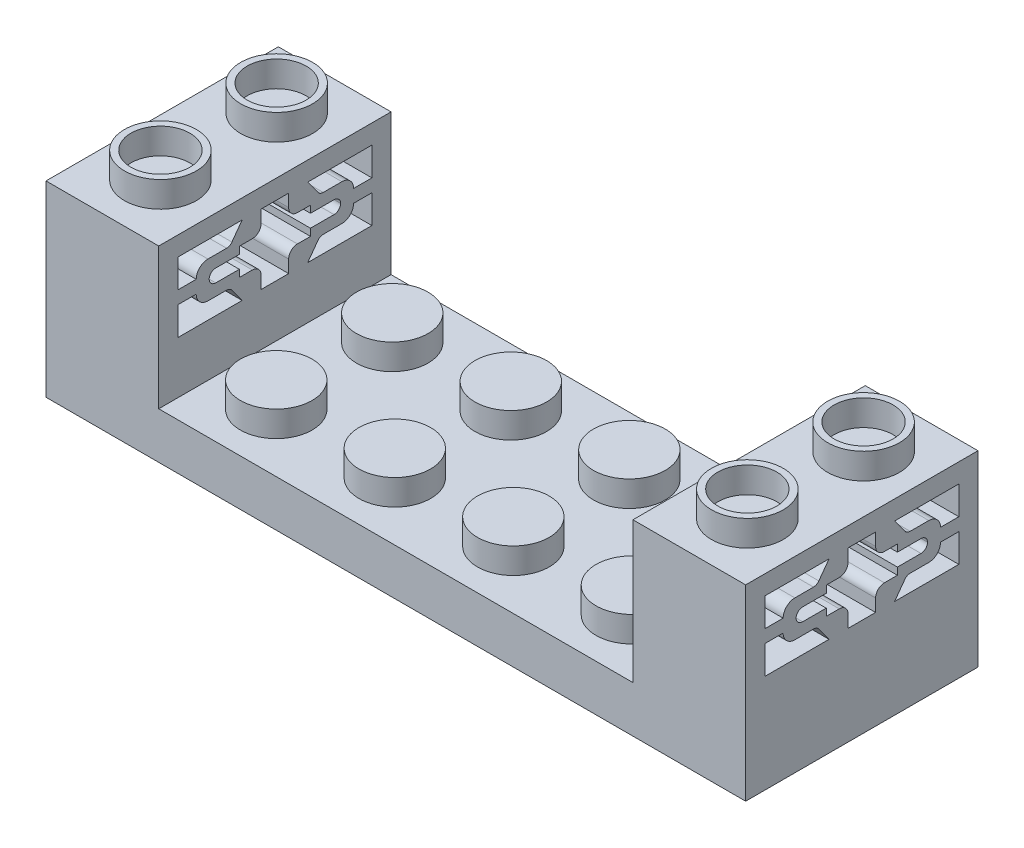
from build123d import *

# Parameters (mm, degrees)
SKETCH2_W               = 47.79
SKETCH2_H               = 12.8
BOSS_EXTRUDE1_DEPTH     = 15.87
CUT_EXTRUDE1_DEPTH      = 30.390269223
CUT_EXTRUDE1_DEPTH_BACK = 30.390269223
SKETCH4_R               = 2.455
SKETCH4_R_2             = 2.015
BOSS_EXTRUDE2_DEPTH     = 1.76
SKETCH5_R               = 2.45
BOSS_EXTRUDE3_DEPTH     = 1.75
SKETCH6_W               = 31.85
SKETCH6_H               = 12.67
CUT_EXTRUDE3_DEPTH      = 1.6
SKETCH7_R               = 1.65
CUT_EXTRUDE4_DEPTH      = 1.85
SKETCH8_W               = 4.69
SKETCH8_H               = 12.83
CUT_EXTRUDE6_DEPTH      = 5.52
SKETCH9_R               = 3.23
SKETCH9_R_2             = 2.83
BOSS_EXTRUDE5_DEPTH     = 1.4
SKETCH10_R              = 1.48
SKETCH10_R_2            = 1.015
BOSS_EXTRUDE6_DEPTH     = 5.32
SKETCH11_R              = 1.48
SKETCH11_R_2            = 1.015
BOSS_EXTRUDE7_DEPTH     = 5.32
CUT_EXTRUDE7_DEPTH      = 52.013004224
FILLET1_R               = 0.6
FILLET2_R               = 0.8
FILLET3_R               = 0.45
FILLET4_R               = 0.45
FILLET5_R               = 0.45


# Some blends are built 0.0001 mm under size
with BuildPart() as part:
    # Sketch2 → Boss-Extrude1 (new body)
    with BuildSketch(Plane.XY):
        Rectangle(SKETCH2_W, SKETCH2_H)
    extrude(amount=-BOSS_EXTRUDE1_DEPTH)

    # Sketch3 → Cut-Extrude1 (cut, two sides: drawn at the far end of the back side and taken through both)
    with BuildSketch(Plane.XY.offset(-CUT_EXTRUDE1_DEPTH_BACK)):
        Polygon((-16.195, 100.567644615), (-16.195, 6.4), (-16.195, -3.23), (16.195, -3.23), (16.195, 6.4), (16.195, 100.567644615), (16.195, 288.902933844), (-16.195, 288.902933844), align=None)
    extrude(amount=CUT_EXTRUDE1_DEPTH + CUT_EXTRUDE1_DEPTH_BACK, mode=Mode.SUBTRACT)

    # Sketch4 → Boss-Extrude2 (add)
    # profile 1 of 4: a face of its own
    with BuildSketch(Plane(origin=(0, 6.4, 0), x_dir=(1, 0, 0), z_dir=(0, 1, 0))):
        with Locations(Location((-20.045, 11.905, 0), (0, 0, 270))):
            Circle(SKETCH4_R)
        with Locations(Location((-20.045, 11.905, 0), (0, 0, 270))):
            Circle(SKETCH4_R_2, mode=Mode.SUBTRACT)
    # profile 2 of 4: a face of its own
    with BuildSketch(Plane(origin=(0, 6.4, 0), x_dir=(1, 0, 0), z_dir=(0, 1, 0))):
        with Locations(Location((-20.045, 3.965, 0), (0, 0, 90))):
            Circle(SKETCH4_R)
        with Locations(Location((-20.045, 3.965, 0), (0, 0, 270))):
            Circle(SKETCH4_R_2, mode=Mode.SUBTRACT)
    # profile 3 of 4: a face of its own
    with BuildSketch(Plane(origin=(0, 6.4, 0), x_dir=(1, 0, 0), z_dir=(0, 1, 0))):
        with Locations(Location((20.045, 3.965, 0), (0, 0, 270))):
            Circle(SKETCH4_R)
        with Locations(Location((20.045, 3.965, 0), (0, 0, 90))):
            Circle(SKETCH4_R_2, mode=Mode.SUBTRACT)
    # profile 4 of 4: a face of its own
    with BuildSketch(Plane(origin=(0, 6.4, 0), x_dir=(1, 0, 0), z_dir=(0, 1, 0))):
        with Locations(Location((20.045, 11.905, 0), (0, 0, 90))):
            Circle(SKETCH4_R)
        with Locations(Location((20.045, 11.905, 0), (0, 0, 90))):
            Circle(SKETCH4_R_2, mode=Mode.SUBTRACT)
    extrude(amount=BOSS_EXTRUDE2_DEPTH)

    # Sketch5 → Boss-Extrude3 (add)
    with BuildSketch(Plane(origin=(0, -3.23, 0), x_dir=(1, 0, 0), z_dir=(0, 1, 0))):
        with Locations(Location((-12.14625, 11.9025, 0), (0, 0, 270))):
            Circle(SKETCH5_R)
        with Locations(Location((-4.04875, 11.9025, 0), (0, 0, 270))):
            Circle(SKETCH5_R)
        with Locations(Location((4.04875, 11.9025, 0), (0, 0, 270))):
            Circle(SKETCH5_R)
        with Locations(Location((12.14625, 11.9025, 0), (0, 0, 270))):
            Circle(SKETCH5_R)
        with Locations(Location((12.14625, 3.9775, 0), (0, 0, 90))):
            Circle(SKETCH5_R)
        with Locations(Location((4.04875, 3.9775, 0), (0, 0, 90))):
            Circle(SKETCH5_R)
        with Locations(Location((-4.04875, 3.9775, 0), (0, 0, 90))):
            Circle(SKETCH5_R)
        with Locations(Location((-12.14625, 3.9775, 0), (0, 0, 90))):
            Circle(SKETCH5_R)
    extrude(amount=BOSS_EXTRUDE3_DEPTH)

    # Sketch6 → Cut-Extrude3 (cut)
    with BuildSketch(Plane.XZ.offset(6.4)):
        with Locations((0, -7.935)):
            Rectangle(SKETCH6_W, SKETCH6_H)
    extrude(amount=-CUT_EXTRUDE3_DEPTH, mode=Mode.SUBTRACT)

    # Sketch7 → Cut-Extrude4 (cut)
    with BuildSketch(Plane.XZ.offset(4.8)):
        with Locations(Location((-12.145, -3.97, 0), (0, 0, 270))):
            Circle(SKETCH7_R)
        with Locations(Location((-4.045, -3.97, 0), (0, 0, 270))):
            Circle(SKETCH7_R)
        with Locations(Location((4.055, -3.97, 0), (0, 0, 270))):
            Circle(SKETCH7_R)
        with Locations(Location((12.155, -3.97, 0), (0, 0, 270))):
            Circle(SKETCH7_R)
        with Locations(Location((12.155, -11.9, 0), (0, 0, 90))):
            Circle(SKETCH7_R)
        with Locations(Location((4.055, -11.9, 0), (0, 0, 90))):
            Circle(SKETCH7_R)
        with Locations(Location((-4.045, -11.9, 0), (0, 0, 90))):
            Circle(SKETCH7_R)
        with Locations(Location((-12.145, -11.9, 0), (0, 0, 90))):
            Circle(SKETCH7_R)
    extrude(amount=-CUT_EXTRUDE4_DEPTH, mode=Mode.SUBTRACT)

    # Sketch8 → Cut-Extrude6 (cut)
    with BuildSketch(Plane.XZ.offset(6.4)):
        with Locations((20.03, -7.935)):
            Rectangle(SKETCH8_W, SKETCH8_H)
        with Locations((-20.03, -7.935)):
            Rectangle(SKETCH8_W, SKETCH8_H)
    extrude(amount=-CUT_EXTRUDE6_DEPTH, mode=Mode.SUBTRACT)

    # Sketch9 → Boss-Extrude5 (add)
    # profile 1 of 5: a face of its own
    with BuildSketch(Plane.XZ.offset(4.8)):
        with BuildLine():
            Line((-15.925, -10.765), (-15.925, -11.165))
            ThreePointArc((-15.925, -11.165), (-12.695, -7.935), (-15.925, -4.705))
            Line((-15.925, -4.705), (-15.925, -5.105))
            ThreePointArc((-15.925, -5.105), (-13.095, -7.935), (-15.925, -10.765))
        make_face()
    # profile 2 of 5: a face of its own
    with BuildSketch(Plane.XZ.offset(4.8)):
        with Locations(Location((-7.9625, -7.935, 0), (0, 0, 270))):
            Circle(SKETCH9_R)
        with Locations(Location((-7.9625, -7.935, 0), (0, 0, 270))):
            Circle(SKETCH9_R_2, mode=Mode.SUBTRACT)
    # profile 3 of 5: a face of its own
    with BuildSketch(Plane.XZ.offset(4.8)):
        with Locations(Location((0, -7.935, 0), (0, 0, 270))):
            Circle(SKETCH9_R)
        with Locations(Location((0, -7.935, 0), (0, 0, 270))):
            Circle(SKETCH9_R_2, mode=Mode.SUBTRACT)
    # profile 4 of 5: a face of its own
    with BuildSketch(Plane.XZ.offset(4.8)):
        with Locations(Location((7.9625, -7.935, 0), (0, 0, 270))):
            Circle(SKETCH9_R)
        with Locations(Location((7.9625, -7.935, 0), (0, 0, 270))):
            Circle(SKETCH9_R_2, mode=Mode.SUBTRACT)
    # profile 5 of 5: a face of its own
    with BuildSketch(Plane.XZ.offset(4.8)):
        with BuildLine():
            ThreePointArc((15.925, -4.705), (12.695, -7.935), (15.925, -11.165))
            Line((15.925, -11.165), (15.925, -10.765))
            ThreePointArc((15.925, -10.765), (13.095, -7.935), (15.925, -5.105))
            Line((15.925, -5.105), (15.925, -4.705))
        make_face()
    extrude(amount=BOSS_EXTRUDE5_DEPTH)

    # Sketch10 → Boss-Extrude6 (add)
    with BuildSketch(Plane.XZ.offset(0.88)):
        with Locations(Location((-19.91, -7.935, 0), (0, 0, 90))):
            Circle(SKETCH10_R)
        with Locations(Location((-19.91, -7.935, 0), (0, 0, 270))):
            Circle(SKETCH10_R_2, mode=Mode.SUBTRACT)
    extrude(amount=BOSS_EXTRUDE6_DEPTH)

    # Sketch11 → Boss-Extrude7 (add)
    with BuildSketch(Plane.XZ.offset(0.88)):
        with Locations(Location((19.91, -7.935, 0), (0, 0, 270))):
            Circle(SKETCH11_R)
        with Locations(Location((19.91, -7.935, 0), (0, 0, 270))):
            Circle(SKETCH11_R_2, mode=Mode.SUBTRACT)
    extrude(amount=BOSS_EXTRUDE7_DEPTH)

    # Sketch12 → Cut-Extrude7 (cut, through all)
    with BuildSketch(Plane(origin=(23.895, 0, 0), x_dir=(0, 0, -1), z_dir=(1, 0, 0))):
        Polygon((10.174082978, 5.09), (14.56, 5.09), (14.56, 3.15), (13.31, 3.15), (13.31, 3.95), (11.008024947, 3.95), align=None)
        Polygon((6.995, 5.09), (8.875, 5.09), (8.875, 3.635), (10.365, 3.635), (10.365, 3.15), (12.425, 3.15), (12.425, 2.27), (10.365, 2.27), (10.365, 1.785), (8.875, 1.785), (8.875, 0.33), (6.995, 0.33), (6.995, 1.785), (5.505, 1.785), (5.505, 2.27), (3.445, 2.27), (3.445, 3.15), (5.505, 3.15), (5.505, 3.635), (6.995, 3.635), align=None)
        Polygon((5.695917022, 0.33), (1.31, 0.33), (1.31, 2.27), (2.56, 2.27), (2.56, 1.47), (4.861975053, 1.47), align=None)
        Polygon((11.008024947, 1.47), (10.174082978, 0.33), (14.56, 0.33), (14.56, 2.27), (13.31, 2.27), (13.31, 1.47), align=None)
        Polygon((4.861975053, 3.95), (5.695917022, 5.09), (1.31, 5.09), (1.31, 3.15), (2.56, 3.15), (2.56, 3.95), align=None)
    extrude(amount=-CUT_EXTRUDE7_DEPTH, mode=Mode.SUBTRACT)

    # Fillet1
    fillet1_edges = [part.edges().sort_by_distance(p)[0] for p in [
        (-20.045, 3.635, -8.875),
        (-20.045, 1.785, -8.875),
        (-20.045, 1.785, -6.995),
        (-20.045, 3.635, -6.995),
        (20.045, 3.635, -8.875),
        (20.045, 1.785, -8.875),
        (20.045, 1.785, -6.995),
        (20.045, 3.635, -6.995),
    ]]
    fillet(fillet1_edges, radius=FILLET1_R)

    # Fillet2
    fillet2_edges = [part.edges().sort_by_distance(p)[0] for p in [
        (20.045, 3.95, -2.56),
        (20.045, 1.47, -2.56),
        (20.045, 1.47, -13.31),
        (20.045, 3.95, -13.31),
        (-20.045, 1.47, -2.56),
        (-20.045, 3.95, -2.56),
        (-20.045, 1.47, -13.31),
        (-20.045, 3.95, -13.31),
    ]]
    fillet(fillet2_edges, radius=FILLET2_R - 0.0001)  # a hair under: the kernel refuses the full size

    # Fillet3
    # the kernel refuses this fillet: 0.45 mm, written as the material it adds along each edge
    with BuildSketch(Plane(origin=(-16.195, 2.27, -12.425), x_dir=(0, 1, 0), z_dir=(-1, 0, 0)), Plane(origin=(-16.195, 3.15, -12.425), x_dir=(0, 0, 1), z_dir=(-1, 0, 0))) as fillet3_piece_1:
        with BuildLine():
            CenterArc((FILLET3_R, -FILLET3_R), FILLET3_R, 90, 90)
            Line((0, -FILLET3_R), (0, 0))
            Line((0, 0), (FILLET3_R, 0))
        make_face()
    extrude(amount=7.7)
    with BuildSketch(Plane(origin=(-16.195, 3.15, -3.445), x_dir=(0, 0, -1), z_dir=(-1, 0, 0)), Plane(origin=(-16.195, 2.27, -3.445), x_dir=(0, 1, 0), z_dir=(-1, 0, 0))) as fillet3_piece_2:
        with BuildLine():
            CenterArc((FILLET3_R, FILLET3_R), FILLET3_R, 180, 90)
            Line((0, FILLET3_R), (0, 0))
            Line((0, 0), (FILLET3_R, 0))
        make_face()
    extrude(amount=7.7)

    # Fillet4
    # the kernel refuses this fillet: 0.45 mm, written as the material it adds along each edge
    with BuildSketch(Plane(origin=(23.895, 3.15, -3.445), x_dir=(0, 0, -1), z_dir=(-1, 0, 0)), Plane(origin=(23.895, 2.27, -3.445), x_dir=(0, 1, 0), z_dir=(-1, 0, 0))) as fillet4_piece_1:
        with BuildLine():
            CenterArc((FILLET4_R, FILLET4_R), FILLET4_R, 180, 90)
            Line((0, FILLET4_R), (0, 0))
            Line((0, 0), (FILLET4_R, 0))
        make_face()
    extrude(amount=7.7)
    with BuildSketch(Plane(origin=(23.895, 3.15, -12.425), x_dir=(0, 0, 1), z_dir=(-1, 0, 0)), Plane(origin=(23.895, 2.27, -12.425), x_dir=(0, 1, 0), z_dir=(-1, 0, 0))) as fillet4_piece_2:
        with BuildLine():
            CenterArc((FILLET4_R, -FILLET4_R), FILLET4_R, 90, 90)
            Line((0, -FILLET4_R), (0, 0))
            Line((0, 0), (FILLET4_R, 0))
        make_face()
    extrude(amount=7.7)

    # Fillet5
    fillet5_edges = [part.edges().sort_by_distance(p)[0] for p in [
        (-20.045, 1.47, -4.861975053),
        (20.045, 1.47, -4.861975053),
        (-20.045, 1.47, -11.008024947),
        (20.045, 1.47, -11.008024947),
        (-20.045, 3.95, -4.861975053),
        (20.045, 3.95, -4.861975053),
        (-20.045, 3.95, -11.008024947),
        (20.045, 3.95, -11.008024947),
    ]]
    fillet(fillet5_edges, radius=FILLET5_R)


solid = part.part
